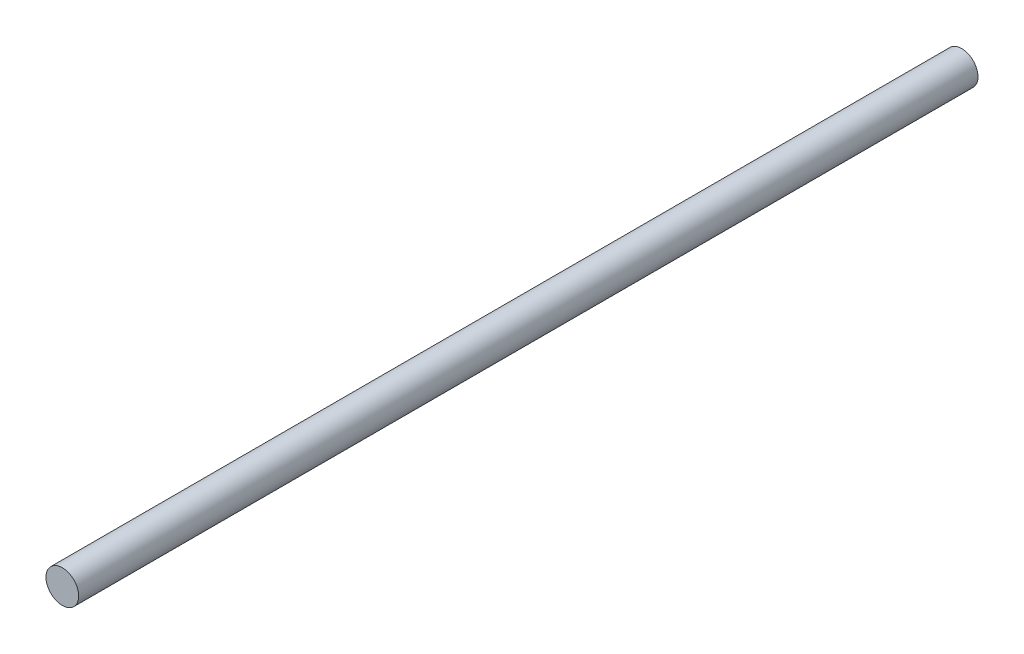
from build123d import *

# Parameters (mm, degrees)
BOSS_EXTRUDE1_DEPTH      = 110
BOSS_EXTRUDE1_DEPTH_BACK = 110
SKETCH1_R                = 4


with BuildPart() as part:
    # Sketch1 → Boss-Extrude1 (new, two sides: drawn at the far end of the back side and taken through both)
    with BuildSketch(Plane.XY.offset(-BOSS_EXTRUDE1_DEPTH_BACK)):
        Circle(SKETCH1_R)
    extrude(amount=BOSS_EXTRUDE1_DEPTH + BOSS_EXTRUDE1_DEPTH_BACK)


solid = part.part
